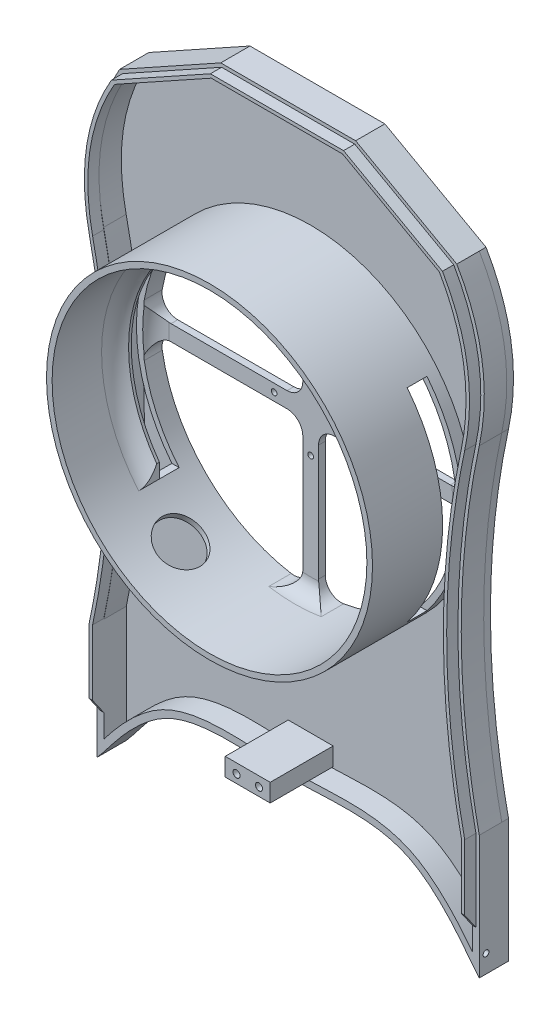
from build123d import *

# Parameters (mm, degrees)
ESQUISSE1_R                  = 70
ESQUISSE1_W                  = 20
ESQUISSE1_H                  = 39.999999999999986
BOSS_EXTRU_1_DEPTH           = 3
ESQUISSE2_W                  = 20
ESQUISSE2_H                  = 8.000000000000004
ESQUISSE2_H_2                = 8.000000000000014
BOSS_EXTRU_2_DEPTH           = 28
ESQUISSE3_R                  = 72.50000000000001
ESQUISSE3_R_2                = 70
BOSS_EXTRU_3_DEPTH           = 45
ESQUISSE4_W                  = 20
ESQUISSE4_H                  = 39.999999999999986
BOSS_EXTRU_4_DEPTH           = 3
BOSS_EXTRU_5_DEPTH           = 13
BOSS_EXTRU_6_DEPTH           = 5
BOSS_EXTRU_7_DEPTH           = 3
CONG_1_DEPTH                 = 10.0000001
CONG_1_2_DEPTH               = 3
ESQUISSE12_R                 = 9.999999999999998
ENL_V_MAT_EXTRU_2_DEPTH      = 14
ESQUISSE13_R                 = 1.2499999999999996
ESQUISSE13_R_2               = 1.2499999999999847
ESQUISSE13_R_3               = 1.2500000000000029
ESQUISSE13_R_4               = 1.2500000000000113
ENL_V_MAT_EXTRU_3_DEPTH      = 10
CHANFREIN2_SIZE              = 15
CHANFREIN2_SIZE_2            = 21.422220101
D_GAGEMENT_M2_52_D           = 3.1
D_GAGEMENT_M2_52_DEPTH       = 10
D_GAGEMENT_M2_52_CSINK_D     = 3.15
D_GAGEMENT_M2_52_CSINK_ANGLE = 90
D_GAGEMENT_M2_52_TIP         = 0.9313339594927185
ENL_V_START                  = 70
ESQUISSE21_W                 = 19.999999999999993
ESQUISSE21_H                 = 10
ENL_V_MAT_EXTRU_4_DEPTH      = 155
BOSS_EXTRU_11_START          = 8
BOSS_EXTRU_11_DEPTH          = 10
ENL_V_MAT_EXTRU_7_DEPTH      = 18.999999999999954
ENL_V_MAT_EXTRU_8_DEPTH      = 8.999999999999957
CONG_6_R                     = 10
CONG_7_R                     = 10


with BuildPart() as part:
    # Esquisse1 → Boss.-Extru.1 (new body)
    with BuildSketch(Plane.XY):
        with BuildLine():
            Line((30, 283.6148203161553), (-30, 283.6148203161553))
            Line((-30, 283.6148203161553), (-75.00000000000001, 258.61482031615526))
            add(Edge.make_bspline(
                [(-75.00000000000001, 258.61482031615526), (-92.42781352708205, 228.5081985162863), (-85.00000000000001, 193.61482031615523)],
                knots=[0, 0, 0, 1, 1, 1], degree=2))
            add(Edge.make_bspline(
                [(-85.00000000000001, 193.61482031615523), (-68.93018343768246, 118.7283020617592), (-85, 43.614820316155225)],
                knots=[0, 0, 0, 1, 1, 1], degree=2))
            Line((-85, 43.614820316155225), (-85, -11.385179683844726))
            add(Edge.make_bspline(
                [(-85, -11.385179683844726), (-81.96838515032597, -8.05743631287527), (-76.79687441104645, -0.5113567415685818), (-66.11439663784589, 10.772785983298427), (-45.473822970943495, 28.2980372880793), (-19.570110111013104, 23.61482031612098), (-7.95e-15, 23.61482031615525)],
                knots=[-0.06126852860693532, -0.06126852860693532, -0.06126852860693532, -0.06126852860693532, 0.0714545913021146, 0.09714605397303369, 0.19564609810225558, 0.4999999999989369, 0.4999999999989369, 0.4999999999989369, 0.4999999999989369], degree=3))
            add(Edge.make_bspline(
                [(85, -11.38517968384474), (81.96838515032597, -8.057436312875248), (76.79687441104643, -0.5113567415685939), (66.1143966378459, 10.772785983298425), (45.47382297094348, 28.298037288079275), (19.570110111013104, 23.61482031612098), (-7.95e-15, 23.61482031615525)],
                knots=[-0.0612685286069355, -0.0612685286069355, -0.0612685286069355, -0.0612685286069355, 0.07145459130211457, 0.09714605397303369, 0.19564609810225558, 0.4999999999989369, 0.4999999999989369, 0.4999999999989369, 0.4999999999989369], degree=3))
            Line((85, -11.38517968384474), (85, 43.614820316155196))
            add(Edge.make_bspline(
                [(85.00000000000001, 193.61482031615523), (68.93018343768246, 118.7283020617592), (85, 43.614820316155196)],
                knots=[0, 0, 0, 1, 1, 1], degree=2))
            add(Edge.make_bspline(
                [(75.00000000000001, 258.61482031615526), (92.42781352708205, 228.50819851628628), (85.00000000000001, 193.61482031615523)],
                knots=[0, 0, 0, 1, 1, 1], degree=2))
            Line((75.00000000000001, 258.61482031615526), (30, 283.6148203161553))
        make_face()
        with Locations((-1.2e-16, 158.6148203161553)):
            Circle(ESQUISSE1_R, mode=Mode.SUBTRACT)
        Polygon((-82, 226.52145792770335), (-60.78679656440361, 205.30825449210684), (-11.28932188134522, 254.80572917516508), (-32.50252531694162, 276.01893261076157), align=None, mode=Mode.SUBTRACT)
        Polygon((60.78679656440361, 205.30825449210684), (11.28932188134522, 254.80572917516508), (32.50252531694162, 276.01893261076157), (82, 226.52145792770335), align=None, mode=Mode.SUBTRACT)
        with Locations((0, 55.4995854823676)):
            Rectangle(ESQUISSE1_W, ESQUISSE1_H, mode=Mode.SUBTRACT)
    extrude(amount=BOSS_EXTRU_1_DEPTH)

    # Esquisse2 → Boss.-Extru.2 (add)
    with BuildSketch(Plane.XY.offset(3)):
        with Locations((0, 31.499585482367607)):
            Rectangle(ESQUISSE2_W, ESQUISSE2_H)
        with Locations((0, 79.49958548236759)):
            Rectangle(ESQUISSE2_W, ESQUISSE2_H_2)
    extrude(amount=BOSS_EXTRU_2_DEPTH)

    # Esquisse3 → Boss.-Extru.3 (add)
    with BuildSketch(Plane.XY.offset(3)):
        with Locations(Location((-1.2e-16, 158.6148203161553, 0), (0, 0, 180))):
            Circle(ESQUISSE3_R)
        with Locations((-1.2e-16, 158.6148203161553)):
            Circle(ESQUISSE3_R_2, mode=Mode.SUBTRACT)
    extrude(amount=BOSS_EXTRU_3_DEPTH)

    # Esquisse4 → Boss.-Extru.4 (add)
    with BuildSketch(Plane(origin=(0, 0, 0), x_dir=(-1, 0, 0), z_dir=(0, 0, -1))):
        with Locations((0, 55.4995854823676)):
            Rectangle(ESQUISSE4_W, ESQUISSE4_H)
        Polygon((82, 226.52145792770335), (60.786796564403595, 205.30825449210684), (11.289321881345224, 254.80572917516508), (32.5025253169417, 276.0189326107615), align=None)
        Polygon((-82, 226.5214579277034), (-60.786796564403595, 205.30825449210684), (-11.289321881345224, 254.80572917516508), (-32.50252531694157, 276.01893261076157), align=None)
    extrude(amount=-BOSS_EXTRU_4_DEPTH)

    # Esquisse7 → Boss.-Extru.5 (add)
    with BuildSketch(Plane(origin=(0, 0, 0), x_dir=(-1, 0, 0), z_dir=(0, 0, -1))):
        with BuildLine():
            Line((-85.00000000300668, 43.61482030232988), (-85, -11.38517968384474))
            add(Edge.make_bspline(
                [(-85, -11.38517968384474), (-81.96838515032597, -8.057436312875248), (-76.79687441104643, -0.5113567415685939), (-66.1143966378459, 10.772785983298425), (-45.47382297094348, 28.298037288079275), (-19.570110111013104, 23.61482031612098), (7.95e-15, 23.61482031615525)],
                knots=[-0.0612685286069355, -0.0612685286069355, -0.0612685286069355, -0.0612685286069355, 0.07145459130211457, 0.09714605397303369, 0.19564609810225558, 0.4999999999989369, 0.4999999999989369, 0.4999999999989369, 0.4999999999989369], degree=3))
            add(Edge.make_bspline(
                [(7.95e-15, 23.61482031615525), (19.570110111013104, 23.61482031612098), (45.473822970943495, 28.2980372880793), (66.11439663784589, 10.772785983298427), (76.79687441104645, -0.5113567415685818), (81.96838515032597, -8.05743631287527), (85, -11.385179683844726)],
                knots=[-0.06126852860693532, -0.06126852860693532, -0.06126852860693532, -0.06126852860693532, 0.243085373289746, 0.34158541741896786, 0.367276880089887, 0.49999999999893696, 0.49999999999893696, 0.49999999999893696, 0.49999999999893696], degree=3))
            Line((85, -11.385179683844726), (85, 43.614820316155225))
            add(Edge.make_bspline(
                [(85, 43.614820316155225), (68.93018343730546, 118.72830206346005), (85.00000000069963, 193.61482031954668)],
                knots=[0, 0, 0, 1, 1, 1], degree=2))
            add(Edge.make_bspline(
                [(85.00000000069963, 193.61482031954668), (92.42781354091423, 228.50819858694288), (74.99999993081197, 258.61482043555964)],
                knots=[0, 0, 0, 1, 1, 1], degree=2))
            Line((74.99999993081197, 258.61482043555964), (30, 283.6148203161553))
            Line((30, 283.6148203161553), (-30, 283.6148203161553))
            Line((-30, 283.6148203161553), (-75.00000000000001, 258.6148203161552))
            add(Edge.make_bspline(
                [(-75.00000000000001, 258.6148203161552), (-92.42781352749573, 228.50819851560686), (-84.9999999997082, 193.61482031458087)],
                knots=[0, 0, 0, 1, 1, 1], degree=2))
            add(Edge.make_bspline(
                [(-84.9999999997082, 193.61482031458087), (-68.93018343641985, 118.72830205407783), (-85.00000000300668, 43.61482030232988)],
                knots=[0, 0, 0, 1, 1, 1], degree=2))
        make_face()
        with BuildLine():
            Line((-82.00000000298942, 43.29813740875661), (-82.00000000046484, -2.881948230767895))
            add(Edge.make_bspline(
                [(-82.00000000046484, -2.881948230767895), (-81.74758887919461, -2.5573191906772004), (-81.24788778698097, -1.915721981313908), (-80.19889714359618, -0.5779500442992964), (-78.82838055937837, 1.14413615694196), (-77.08231001751294, 3.26858048079266), (-74.62250331713605, 6.135499344934203), (-71.32221905349847, 9.663339212050094), (-67.04373462711776, 13.74902636799347), (-62.413654050339375, 17.54430692205476), (-57.434160972674555, 20.84954650545775), (-52.122819508505174, 23.410210157956122), (-44.81993316469171, 25.812608107223937), (-35.34088519646024, 27.266380874308805), (-23.65508269305504, 27.43800281826682), (-13.784180628681382, 26.993416448234804), (-5.884198417396422, 26.686995172186517), (-1.9641351402751233, 26.61482031615181), (-5.25366e-12, 26.61482031615525)],
                knots=[0.00387879301185991, 0.00387879301185991, 0.00387879301185991, 0.00387879301185991, 0.01163068687103298, 0.01938258073020606, 0.03488636844855222, 0.05039015616689838, 0.06589394388524453, 0.09690151932193684, 0.12790909475862916, 0.15891667019532146, 0.1899242456320138, 0.22093182106870612, 0.2519393965053984, 0.31395454737878303, 0.37596969825216764, 0.43798484912555224, 0.46899242456224455, 0.4999999999989369, 0.4999999999989369, 0.4999999999989369, 0.4999999999989369], degree=3))
            add(Edge.make_bspline(
                [(-5.25366e-12, 26.61482031615525), (1.9641351402848126, 26.61482031615181), (5.884198417425449, 26.686995172187217), (13.784180628749516, 26.993416448237916), (23.655082693171423, 27.43800281827109), (35.34088519663145, 27.266380874299582), (44.819933164904015, 25.812608107179003), (52.122819508744634, 23.410210157862313), (57.434160972930165, 20.849546505312016), (62.413654050599526, 17.54430692186186), (67.04373462738207, 13.749026367758288), (71.3222190537612, 9.66333921178537), (74.62250331739908, 6.1354993446411425), (77.08231001776934, 3.268580480486858), (78.82838055962917, 1.1441361566313242), (80.19889714384104, -0.577950044609259), (81.24788778722042, -1.9157219816205033), (81.74758887943085, -2.5573191909806505), (82.00000000069966, -2.881948231069862)],
                knots=[-0.06126852860693532, -0.06126852860693532, -0.06126852860693532, -0.06126852860693532, -0.03026095317009034, 0.00074662226675465, 0.06276177314044462, 0.1247769240141346, 0.18679207488782457, 0.21779965032466955, 0.24880722576151454, 0.27981480119835955, 0.3108223766352045, 0.34182995207204947, 0.3728375275088945, 0.38834131522731696, 0.4038451029457395, 0.419348890664162, 0.4271007845233732, 0.43485267838258446, 0.43485267838258446, 0.43485267838258446, 0.43485267838258446], degree=3))
            Line((82.00000000069966, -2.881948231069862), (82.00000000067097, 43.29813741899179))
            add(Edge.make_bspline(
                [(82.00000000067097, 43.29813741899179), (81.33102916154041, 46.43791363807862), (80.0708459202374, 52.7462448934385), (77.89276900780747, 65.33171231348604), (75.79783241381435, 81.07201672041492), (74.29320015678675, 99.95165906042455), (73.79696955750731, 118.82683014148617), (74.30967373844007, 137.6950290696561), (75.8308271228173, 156.55386439120204), (77.9395452141792, 172.26499873918505), (80.12878829819708, 184.8206522136442), (81.39439988849415, 191.11083936856429), (82.0662536642805, 194.2418279441001)],
                knots=[0.4985417972747512, 0.4985417972747512, 0.4985417972747512, 0.4985417972747512, 0.4987185948050439, 0.49889539233533664, 0.49924898739592205, 0.4996025824565075, 0.499956177517093, 0.5003097725776784, 0.5006633676382639, 0.5010169626988493, 0.5011937602291421, 0.5013705577594347, 0.5013705577594347, 0.5013705577594347, 0.5013705577594347], degree=3))
            add(Edge.make_bspline(
                [(82.0662536642805, 194.2418279441001), (82.36083731312056, 195.625839445594), (82.89742485421858, 198.4235503613443), (83.714251033711, 203.91838292941813), (84.27758065412904, 210.70054894684807), (84.21838333393626, 218.67408101126492), (83.42843935890235, 226.4975170788434), (81.90762625843804, 234.17659603057092), (79.65542424064712, 241.7178864599615), (77.16315284471366, 247.8980603693058), (74.80418141442156, 252.7705468603318), (73.49135669425267, 255.2028339850259), (72.81286109097238, 256.39802085383036)],
                knots=[0.49861944776737316, 0.49861944776737316, 0.49861944776737316, 0.49861944776737316, 0.4987747460750024, 0.49893004438263155, 0.4992406409978899, 0.4995512376131483, 0.4998618342284067, 0.500172430843665, 0.5004830274589235, 0.5007936240741819, 0.5009489223818111, 0.5011042206894403, 0.5011042206894403, 0.5011042206894403, 0.5011042206894403], degree=3))
            Line((72.81286109097238, 256.39802085383036), (29.222621915407792, 280.6148203161553))
            Line((29.222621915407792, 280.6148203161553), (-29.222621915407792, 280.6148203161553))
            Line((-29.222621915407792, 280.6148203161553), (-72.81286115702135, 256.3980207374735))
            add(Edge.make_bspline(
                [(-72.81286115702135, 256.3980207374735), (-73.49135675770529, 255.20283386941583), (-74.80418147269755, 252.77054674641414), (-77.16315289318865, 247.89806025867443), (-79.655424277748, 241.71788635360764), (-81.90762628328918, 234.17659592945458), (-83.42843937301045, 226.49751698317462), (-84.218383338522, 218.67408092119987), (-84.27758065075236, 210.70054886257512), (-83.71425102470224, 203.91838285019602), (-82.89742484138752, 198.42355028626702), (-82.36083729863131, 195.62583937265438), (-82.06625364901512, 194.24182787224035)],
                knots=[0.4988957793155621, 0.4988957793155621, 0.4988957793155621, 0.4988957793155621, 0.49905107762304524, 0.4992063759305283, 0.49951697254549443, 0.4998275691604606, 0.5001381657754268, 0.500448762390393, 0.5007593590053592, 0.5010699556203253, 0.5012252539278084, 0.5013805522352915, 0.5013805522352915, 0.5013805522352915, 0.5013805522352915], degree=3))
            add(Edge.make_bspline(
                [(-82.06625364901512, 194.24182787224035), (-81.39439987413624, 191.11083929796692), (-80.12878828563427, 184.82065214561896), (-77.9395452048241, 172.26499867626123), (-75.8308271170397, 156.55386433468965), (-74.30967373607704, 137.6950290208267), (-73.79696955781702, 118.82683010037148), (-74.29320015883634, 99.95165902701439), (-75.79783241678282, 81.07201669472563), (-77.89276901092492, 65.33171229423937), (-80.0708459229719, 52.746244879335), (-81.33102916404124, 46.437913626564146), (-82.00000000298942, 43.29813740875661)],
                knots=[0.49862944224191336, 0.49862944224191336, 0.49862944224191336, 0.49862944224191336, 0.4988062397721338, 0.49898303730235416, 0.4993366323627949, 0.49969022742323566, 0.5000438224836764, 0.5003974175441172, 0.5007510126045579, 0.5011046076649986, 0.501281405195219, 0.5014582027254394, 0.5014582027254394, 0.5014582027254394, 0.5014582027254394], degree=3))
        make_face(mode=Mode.SUBTRACT)
    extrude(amount=-BOSS_EXTRU_5_DEPTH)

    # Esquisse8 → Boss.-Extru.6 (add)
    with BuildSketch(Plane.XY.offset(13)):
        with BuildLine():
            Line((-82, 43.61482031644215), (-82, -6.90551327659124))
            Line((-82, -6.90551327659124), (-83.5, -6.905513276591239))
            Line((-83.5, -6.905513276591239), (-83.5, 43.61482031644215))
            add(Edge.make_bspline(
                [(-83.50000000088828, 193.50011049071497), (-82.83344405827677, 190.3905239693707), (-81.577951458443, 184.14319243952028), (-79.40713568871776, 171.67423118622528), (-77.31788584062184, 156.0727347749064), (-75.81415885670212, 137.34702003639742), (-75.31278592210667, 118.61280327347806), (-75.8142080661502, 99.87179495409445), (-77.31795154616925, 81.12582175437683), (-79.40723217029269, 65.49591552787746), (-81.57794223962846, 52.99795873080648), (-82.83356483988493, 46.732925973545925), (-83.5, 43.61482031644215)],
                knots=[0.49862941941988015, 0.49862941941988015, 0.49862941941988015, 0.49862941941988015, 0.49880639973469565, 0.49898338004951115, 0.49933734067914215, 0.49969130130877315, 0.5000452619384042, 0.5003992225680352, 0.5007531831976662, 0.5011071438272972, 0.5012841241421127, 0.501461104456928, 0.501461104456928, 0.501461104456928, 0.501461104456928], degree=3))
            add(Edge.make_bspline(
                [(-73.62917849436529, 257.66044962225794), (-74.33950662751099, 256.4308483343103), (-75.71438979906296, 253.92813612044557), (-78.18863651518429, 248.90927399636368), (-80.80851156020276, 242.5359677522343), (-83.18480823294743, 234.74915438023984), (-84.79906960239148, 226.81401410649843), (-85.651061224971, 218.72767442266885), (-85.74123079952483, 210.4880543229445), (-85.1788699766159, 203.48412934015803), (-84.34883783972245, 197.81307592405906), (-83.80121010695215, 194.9277431075947), (-83.50000000088828, 193.50011049071497)],
                knots=[0.4988802353750164, 0.4988802353750164, 0.4988802353750164, 0.4988802353750164, 0.4990368621426199, 0.4991934889102233, 0.49950674244543025, 0.49981999598063714, 0.500133249515844, 0.500446503051051, 0.5007597565862578, 0.5010730101214648, 0.5012296368890683, 0.5013862636566717, 0.5013862636566717, 0.5013862636566717, 0.5013862636566717], degree=3))
            Line((-73.62917849436529, 257.66044962225794), (-29.611310959906433, 282.1148203162139))
            Line((-29.611310959906433, 282.1148203162139), (29.611310957703903, 282.1148203162139))
            Line((29.611310957703903, 282.1148203162139), (73.62917863107192, 257.6604493865649))
            add(Edge.make_bspline(
                [(83.50000001638345, 193.50011056565933), (83.80018036642666, 194.92712101119932), (84.34580384133966, 197.81105328880346), (85.17244375764085, 203.47991068237147), (85.7315332573726, 210.48166152022984), (85.6390316265877, 218.71976454355476), (84.78627187254959, 226.80562419848658), (83.17280201123295, 234.74131846526842), (80.79885021333278, 242.52970014832113), (78.18224028064766, 248.90513582189507), (75.71137383547376, 253.92620783941894), (74.33847963034299, 256.4301607850666), (73.62917863107192, 257.6604493865649)],
                knots=[0.4986194030973504, 0.4986194030973504, 0.4986194030973504, 0.4986194030973504, 0.49877567569220316, 0.49893194828705584, 0.49924449347676125, 0.4995570386664667, 0.49986958385617214, 0.5001821290458776, 0.500494674235583, 0.5008072194252884, 0.5009634920201411, 0.5011197646149939, 0.5011197646149939, 0.5011197646149939, 0.5011197646149939], degree=3))
            add(Edge.make_bspline(
                [(83.50000000132022, 43.61482031606817), (82.83475870600542, 46.73318650533274), (81.58139596009276, 52.998660630681975), (79.41458270266664, 65.49742601085869), (77.32905594770482, 81.12809202298533), (75.8280126146142, 99.87461280876356), (75.32749017494459, 118.61579812422342), (75.82796082624287, 137.34982431293489), (77.328986799922, 156.07499026255138), (79.4144811529493, 171.6757088896715), (81.5814056785719, 184.14390965505615), (82.83463157126009, 190.39072438520805), (83.50000001638345, 193.50011056565933)],
                knots=[0.49853889554254727, 0.49853889554254727, 0.49853889554254727, 0.49853889554254727, 0.4987155589278016, 0.498892222313056, 0.4992455490835648, 0.4995988758540735, 0.49995220262458223, 0.500305529395091, 0.5006588561655997, 0.5010121829361085, 0.5011888463213628, 0.5013655097066172, 0.5013655097066172, 0.5013655097066172, 0.5013655097066172], degree=3))
            Line((83.50000000132022, 43.61482031606817), (83.50000000132023, -6.905513276047638))
            Line((83.50000000132023, -6.905513276047638), (82.0000000013202, -6.905513276047638))
            Line((82.0000000013202, -6.905513276047638), (82.00000000132022, 43.614820316320746))
            add(Edge.make_bspline(
                [(82.00000000132022, 43.614820316320746), (81.33723947816034, 46.7304185758104), (80.08860483794061, 52.99004603333315), (77.92973886842202, 65.47834652832897), (75.85170867994044, 81.09689814642189), (74.3559276694107, 99.83021966050596), (73.85712408007983, 118.55881129989208), (74.35582532571837, 137.28020283223125), (75.85155860923669, 155.9920443312817), (77.92956295961693, 171.58046382349616), (80.08857296474383, 184.03800183806794), (81.33709595783976, 190.2788434913582), (82.00000001600993, 193.38540073711252)],
                knots=[0.4985417972742992, 0.4985417972742992, 0.4985417972742992, 0.4985417972742992, 0.4987179628294005, 0.49889412838450187, 0.4992464594947046, 0.4995987906049073, 0.49995112171511, 0.5003034528253127, 0.5006557839355155, 0.5010081150457182, 0.5011842806008195, 0.5013604461559208, 0.5013604461559208, 0.5013604461559208, 0.5013604461559208], degree=3))
            add(Edge.make_bspline(
                [(82.00000001600993, 193.38540073711252), (82.29346048041762, 194.7978226687351), (82.82663064355893, 197.652671948952), (83.63212881646899, 203.25855197382828), (84.1728138230599, 210.1755768728673), (84.07294491481852, 218.3040814933408), (83.22884367918861, 226.27594557999853), (81.64035681701036, 234.097019158183), (79.3069218593897, 241.7739961532146), (76.7354887728885, 248.06216221105439), (74.30643259045006, 253.01783735470096), (72.95598863558249, 255.49098090717476), (72.25835726199485, 256.70607845699425)],
                knots=[0.4986194477654942, 0.4986194477654942, 0.4986194477654942, 0.4986194477654942, 0.49877474607292827, 0.49893004438036226, 0.49924064099523024, 0.49955123761009823, 0.4998618342249662, 0.5001724308398343, 0.5004830274547023, 0.5007936240695703, 0.5009489223770043, 0.5011042206844383, 0.5011042206844383, 0.5011042206844383, 0.5011042206844383], degree=3))
            Line((72.25835726199485, 256.70607845699425), (29.22262191540775, 280.61482031620943))
            Line((29.22262191540775, 280.61482031620943), (-29.22262191981294, 280.61482031620943))
            Line((-29.22262191981294, 280.61482031620943), (-72.25835712695147, 256.70607868945))
            add(Edge.make_bspline(
                [(-72.25835712695147, 256.70607868945), (-72.95802915898925, 255.49237495479287), (-74.3124255714403, 253.0217514261781), (-76.74818614881062, 248.07058644741224), (-79.32608618630489, 241.78680651383777), (-81.66416789336581, 234.1131182441957), (-83.2542409587311, 226.29326705332315), (-84.09685129946305, 218.32048126899335), (-84.19212482292441, 210.18887550068112), (-83.64494985678338, 203.26734405789813), (-82.83269364294611, 197.65689006930367), (-82.29551867414538, 194.7991227406761), (-82.00000000088761, 193.38540066107288)],
                knots=[0.49889577930555873, 0.49889577930555873, 0.49889577930555873, 0.49889577930555873, 0.4990517932109185, 0.49920780711627827, 0.4995198349269978, 0.49983186273771735, 0.5001438905484369, 0.5004559183591564, 0.500767946169876, 0.5010799739805956, 0.5012359878859554, 0.501392001791315, 0.501392001791315, 0.501392001791315, 0.501392001791315], degree=3))
            add(Edge.make_bspline(
                [(-82.00000000088761, 193.38540066107288), (-81.3347314968121, 190.278453621151), (-80.08169577162528, 184.03660279876092), (-77.91493577123617, 171.57757879671476), (-75.82944919031709, 155.9876334862995), (-74.32833162609424, 137.2747071267769), (-73.8278296440052, 118.55292913279284), (-74.32842400540483, 99.82467258306185), (-75.82958464198126, 81.09241870233988), (-77.91509451247629, 65.47536081133588), (-80.0817245429236, 52.98865662559274), (-81.33486099358275, 46.72990274865894), (-82, 43.61482031644215)],
                knots=[0.4986294422430372, 0.4986294422430372, 0.4986294422430372, 0.4986294422430372, 0.49880623977317085, 0.4989830373033045, 0.4993366323635719, 0.4996902274238393, 0.5000438224841066, 0.500397417544374, 0.5007510126046413, 0.5011046076649086, 0.5012814051950423, 0.501458202725176, 0.501458202725176, 0.501458202725176, 0.501458202725176], degree=3))
        make_face()
    extrude(amount=BOSS_EXTRU_6_DEPTH)

    # Esquisse9 → Boss.-Extru.7 (add)
    with BuildSketch(Plane(origin=(0, 0, 0), x_dir=(-1, 0, 0), z_dir=(0, 0, -1))):
        Polygon((-3.5, 228.6148203161553), (-3.5000000000000013, 162.1148203161553), (-70, 162.1148203161553), (-70, 155.1148203161553), (-3.5000000000000013, 155.1148203161553), (-3.5, 88.61482031615527), (3.5, 88.61482031615527), (3.500000000000002, 155.1148203161553), (70, 155.1148203161553), (70, 162.1148203161553), (3.5000000000000013, 162.1148203161553), (3.5, 228.6148203161553), align=None)
    extrude(amount=-BOSS_EXTRU_7_DEPTH)

    # Congé1: read off the stored shape, not the designer's step
    # Congé1 outline → Congé1 (add)
    with BuildSketch(Plane.XY):
        with BuildLine():
            ThreePointArc((-11.666666667, 89.593889513), (0, 88.614820316), (11.666666667, 89.593889513))
            ThreePointArc((11.666666667, 89.593889513), (5.981519429, 91.149644283), (3.5, 96.495982594))
            Line((3.5, 96.495982594), (3.5, 155.114820316))
            Line((3.5, 155.114820316), (62.118837723, 155.114820316))
            ThreePointArc((62.118837723, 155.114820316), (67.465176034, 152.633300886), (69.020930803, 146.948153649))
            ThreePointArc((69.020930803, 146.948153649), (70, 158.614820316), (69.020930803, 170.281486983))
            ThreePointArc((69.020930803, 170.281486983), (67.465176033, 164.596339746), (62.118837723, 162.114820316))
            Line((62.118837723, 162.114820316), (3.5, 162.114820316))
            Line((3.5, 162.114820316), (3.5, 220.733658039))
            ThreePointArc((3.5, 220.733658039), (5.98151943, 226.07999635), (11.666666667, 227.635751119))
            ThreePointArc((11.666666667, 227.635751119), (0, 228.614820316), (-11.666666667, 227.635751119))
            ThreePointArc((-11.666666667, 227.635751119), (-5.98151943, 226.07999635), (-3.5, 220.733658039))
            Line((-3.5, 220.733658039), (-3.5, 162.114820316))
            Line((-3.5, 162.114820316), (-62.118837723, 162.114820316))
            ThreePointArc((-62.118837723, 162.114820316), (-67.465176033, 164.596339746), (-69.020930803, 170.281486983))
            ThreePointArc((-69.020930803, 170.281486983), (-70, 158.614820316), (-69.020930803, 146.948153649))
            ThreePointArc((-69.020930803, 146.948153649), (-67.465176034, 152.633300886), (-62.118837723, 155.114820316))
            Line((-62.118837723, 155.114820316), (-3.5, 155.114820316))
            Line((-3.5, 155.114820316), (-3.5, 96.495982594))
            ThreePointArc((-3.5, 96.495982594), (-5.981519429, 91.149644283), (-11.666666667, 89.593889513))
        make_face()
    extrude(amount=CONG_1_DEPTH)

    # Cong_1 2 outline → Cong_1 2 (add)
    with BuildSketch(Plane.XY):
        with BuildLine():
            ThreePointArc((-10.5, 155.114820316), (-5.550252532, 153.064567784), (-3.5, 148.114820316))
            Line((-3.5, 148.114820316), (-3.5, 155.114820316))
            Line((-3.5, 155.114820316), (-10.5, 155.114820316))
        make_face()
        with BuildLine():
            Line((3.5, 155.114820316), (3.5, 148.114820316))
            ThreePointArc((3.5, 148.114820316), (5.550252532, 153.064567784), (10.5, 155.114820316))
            Line((10.5, 155.114820316), (3.5, 155.114820316))
        make_face()
        with BuildLine():
            ThreePointArc((-3.5, 169.114820316), (-5.550252532, 164.165072848), (-10.5, 162.114820316))
            Line((-10.5, 162.114820316), (-3.5, 162.114820316))
            Line((-3.5, 162.114820316), (-3.5, 169.114820316))
        make_face()
        with BuildLine():
            Line((3.5, 162.114820316), (10.5, 162.114820316))
            ThreePointArc((10.5, 162.114820316), (5.550252532, 164.165072848), (3.5, 169.114820316))
            Line((3.5, 169.114820316), (3.5, 162.114820316))
        make_face()
    extrude(amount=CONG_1_2_DEPTH)

    # Cong_1 3 outline → Cong_1 3 (revolve, cut)
    with BuildSketch(Plane.XZ.offset(-158.614820316)):
        with BuildLine():
            Line((0, 10.0000001), (0, 3))
            Line((0, 3), (63, 3))
            ThreePointArc((63, 3), (67.949747468, 5.050252532), (70, 10))
            Line((70, 10), (0, 10.0000001))
        make_face()
    revolve(axis=Axis((0, 158.614820316, 0), (0, 0, 1)), mode=Mode.SUBTRACT)

    # Esquisse12 → Enlèv. mat.-Extru.2 (cut)
    with BuildSketch(Plane(origin=(32.43223190524735, 56.17427346274418, 0), x_dir=(0, 0, -1), z_dir=(-0.5000000000000041, -0.8660254037844364, 0))):
        with Locations(Location((-23, -82.83270794216602, 0), (0, 0, 90))):
            Circle(ESQUISSE12_R)
    extrude(amount=-ENL_V_MAT_EXTRU_2_DEPTH, mode=Mode.SUBTRACT)

    # Esquisse13 → Enlèv. mat.-Extru.3 (cut)
    with BuildSketch(Plane.XY.offset(3)):
        with Locations((-16.25, 158.6148203161553)):
            Circle(ESQUISSE13_R)
        with Locations((-1.6653e-13, 174.86482031615546)):
            Circle(ESQUISSE13_R_2)
        with Locations((16.249999999999936, 158.61482031615557)):
            Circle(ESQUISSE13_R_3)
        with Locations((0, 142.36482031615546)):
            Circle(ESQUISSE13_R_4)
    extrude(amount=-ENL_V_MAT_EXTRU_3_DEPTH, mode=Mode.SUBTRACT)

    # Chanfrein2
    # the kernel refuses this chamfer: 21.422220101, 15 mm, written as the material it takes off along each edge
    with BuildSketch(Plane(origin=(138.82400230113143, -6.905513276047638, 18), x_dir=(0, 0, -1), z_dir=(-1, 0, 0))) as chanfrein2_piece_1_section:
        Polygon((CHANFREIN2_SIZE, 0), (0, -CHANFREIN2_SIZE_2), (0, 0), align=None)
    chanfrein2_piece_1 = extrude(amount=112.14800459962244, mode=Mode.PRIVATE)
    chanfrein2_piece_1 = split(chanfrein2_piece_1, bisect_by=Plane(origin=(138.82400230113143, -6.905513276047638, 13), z_dir=(0, 0, 1)), keep=Keep.TOP, mode=Mode.PRIVATE)
    add(chanfrein2_piece_1, mode=Mode.SUBTRACT)
    with BuildSketch(Plane(origin=(-26.675997700188844, -6.905513276591273, 18), x_dir=(0, 0, -1), z_dir=(-1, 5.9e-16, 0))) as chanfrein2_piece_2_section:
        Polygon((CHANFREIN2_SIZE, 0), (0, -CHANFREIN2_SIZE_2), (0, 0), align=None)
    chanfrein2_piece_2 = extrude(amount=112.14800459962231, mode=Mode.PRIVATE)
    chanfrein2_piece_2 = split(chanfrein2_piece_2, bisect_by=Plane(origin=(-26.675997700188844, -6.905513276591273, 13), z_dir=(0, 0, 1)), keep=Keep.TOP, mode=Mode.PRIVATE)
    add(chanfrein2_piece_2, mode=Mode.SUBTRACT)

    # Dégagement M2.52
    with Locations(Plane.XY.offset(31)):
        with Locations((-5, 79.249585482), (5, 79.249585482), (-5, 31.249585482), (5, 31.249585482)):
            CounterSinkHole(D_GAGEMENT_M2_52_D / 2, D_GAGEMENT_M2_52_CSINK_D / 2, depth=D_GAGEMENT_M2_52_DEPTH, counter_sink_angle=D_GAGEMENT_M2_52_CSINK_ANGLE)
            with Locations((0, 0, -(D_GAGEMENT_M2_52_DEPTH + D_GAGEMENT_M2_52_TIP / 2))):  # 118° drill point
                Cone(0, D_GAGEMENT_M2_52_D / 2, D_GAGEMENT_M2_52_TIP, mode=Mode.SUBTRACT)

    # Esquisse20 → Dégagement M21 (revolve, cut)
    with BuildSketch(Plane(origin=(-85, -3.385179683844726, 10), x_dir=(0, 0, 1), z_dir=(0, 1, 0))):
        Polygon((0, 0), (-1.17e-15, 4.781118804735829), (1.2999999999999992, 4), (1.2999999999999905, 0.02500000000001112), (1.3249999999999997, -1.73e-15), align=None)
    d_gagement_m21 = revolve(axis=Axis((-91.35, -3.385179683844726, 10), (1, 0, 0)), mode=Mode.SUBTRACT)

    # Symétrie1: Dégagement M21 across plane
    add(d_gagement_m21.mirror(Plane(origin=(0, 0, 0), x_dir=(0, 0, 1), z_dir=(1, 0, 0))), mode=Mode.SUBTRACT)

    # Esquisse21 → Enlèv. mat.-Extru.4 (cut)
    with BuildSketch(Plane(origin=(0, 0, 0), x_dir=(1, 0, 0), z_dir=(0, 1, 0)).offset(ENL_V_START)):
        with Locations((-63.5, -13.000000000000004)):
            Rectangle(ESQUISSE21_W, ESQUISSE21_H)
    extrude(amount=ENL_V_MAT_EXTRU_4_DEPTH, mode=Mode.SUBTRACT)

    # Boss.-Extru.11: read off the stored shape, not the designer's step
    # Boss.-Extru.11 outline → Boss.-Extru.11 (add)
    with BuildSketch(Plane.XY.offset(BOSS_EXTRU_11_START)):
        with BuildLine():
            Line((-53.5, 109.686301025), (-53.5, 207.543339607))
            ThreePointArc((-53.5, 207.543339607), (-72.5, 158.614820316), (-53.5, 109.686301025))
        make_face()
    boss_extru_11 = extrude(amount=BOSS_EXTRU_11_DEPTH)

    # Esquisse23 → Enlèv. mat.-Extru.7 (cut)
    with BuildSketch(Plane(origin=(-53.5, 0, 0), x_dir=(0, 0, -1), z_dir=(1, 0, 0))):
        Polygon((-16.8, 203.75626468826198), (-16.799999999999994, 113.47337594404861), (-8.000000000000004, 113.47337594404861), (-8.000000000000004, 203.75626468826198), align=None)
    enl_v_mat_extru_7 = extrude(amount=-ENL_V_MAT_EXTRU_7_DEPTH, mode=Mode.SUBTRACT)

    # Esquisse24 → Enlèv. mat.-Extru.8 (cut)
    with BuildSketch(Plane.XY.offset(18.000000000000004)):
        with BuildLine():
            Line((-53.5, 119.96575823180447), (-53.5, 197.2638824005062))
            ThreePointArc((-53.500000000000014, 197.2638824005062), (-66.00000000000006, 158.61482031615535), (-53.50000000000001, 119.96575823180447))
        make_face()
    enl_v_mat_extru_8 = extrude(amount=-ENL_V_MAT_EXTRU_8_DEPTH, mode=Mode.SUBTRACT)

    # Congé6
    # the kernel refuses this fillet: 10 mm, written as the material it adds along each edge
    with BuildSketch(Plane(origin=(-1.2e-16, 158.6148203161553, 18.000000000000004), x_dir=(-0.5514715879866191, -0.8341936751399621, 0), z_dir=(0.8341936751399621, -0.5514715879866191, 0))) as cong_6_piece_1_section:
        with BuildLine():
            CenterArc((60, -7.999999999999968), CONG_6_R, 0, 53.130102354155675)
            Line((66.00000000000004, 0), (66.12000000000005, 0.16000000000000014))
            ThreePointArc((66.12000000000005, 0.16000000000000014), (68.00000000000003, 0.20000000000000284), (70.00000000000001, 0.1999999999999993))
            Line((70.00000000000001, 0.1999999999999993), (70.20000000000002, 0))
            Line((70.20000000000002, 0), (70.20000000000002, -7.999999999999968))
            Line((70.20000000000002, -7.999999999999968), (70.00000000000001, -7.999999999999968))
        make_face()
    cong_6_piece_1 = revolve(axis=Axis((-1.2e-16, 158.6148203161553, 18.000000000000004), (0, 0, -1)), revolution_arc=113.0639425204784, mode=Mode.PRIVATE)
    cong_6_piece_1 = split(cong_6_piece_1, bisect_by=Plane(origin=(-53.5, 158.6148203161553, 18.000000000000004), z_dir=(-1, 0, 0)), keep=Keep.TOP, mode=Mode.PRIVATE)
    add(cong_6_piece_1)

    # Symétrie3: Boss.-Extru.11, Enlèv. mat.-Extru.7, Enlèv. mat.-Extru.8 across plane
    add(boss_extru_11.mirror(Plane(origin=(0, 0, 0), x_dir=(0, 0, 1), z_dir=(1, 0, 0))))
    add(enl_v_mat_extru_7.mirror(Plane(origin=(0, 0, 0), x_dir=(0, 0, 1), z_dir=(1, 0, 0))), mode=Mode.SUBTRACT)
    add(enl_v_mat_extru_8.mirror(Plane(origin=(0, 0, 0), x_dir=(0, 0, 1), z_dir=(1, 0, 0))), mode=Mode.SUBTRACT)

    # Congé7
    # the kernel refuses this fillet: 10 mm, written as the material it adds along each edge
    with BuildSketch(Plane(origin=(-1.2e-16, 158.6148203161553, 18), x_dir=(1, 0, 0), z_dir=(0, 1, 0))) as cong_7_piece_1_section:
        with BuildLine():
            CenterArc((60, -7.999999999999986), CONG_7_R, 0, 53.130102354155774)
            Line((66.00000000000003, -7.11e-15), (66.12000000000003, 0.15999999999999304))
            ThreePointArc((66.12000000000003, 0.15999999999999304), (68.00000000000003, 0.1999999999999993), (70, 0.1999999999999993))
            Line((70, 0.1999999999999993), (70.19999999999999, 0))
            Line((70.19999999999999, 0), (70.2, -7.999999999999986))
            Line((70.2, -7.999999999999986), (70, -7.999999999999986))
        make_face()
    cong_7_piece_1 = revolve(axis=Axis((-1.2e-16, 158.6148203161553, 18), (0, 0, -1)), revolution_arc=56.52804379024537, mode=Mode.PRIVATE)
    cong_7_piece_1 = split(cong_7_piece_1, bisect_by=Plane(origin=(53.5, 158.6148203161553, 18), z_dir=(1, 0, 0)), keep=Keep.TOP, mode=Mode.PRIVATE)
    add(cong_7_piece_1)
    with BuildSketch(Plane(origin=(-1.2e-16, 158.6148203161553, 18), x_dir=(0.5515287684006154, 0.8341558713013415, 0), z_dir=(-0.8341558713013415, 0.5515287684006154, 0))) as cong_7_piece_2_section:
        with BuildLine():
            CenterArc((59.99999999999998, -7.9999999999999565), CONG_7_R, 0, 53.13010235415546)
            Line((66.00000000000006, -3.55e-15), (66.12000000000006, 0.15999999999999656))
            ThreePointArc((66.12000000000006, 0.15999999999999656), (68, 0.19999999999999926), (69.99999999999999, 0.19999999999999926))
            Line((69.99999999999999, 0.19999999999999926), (70.19999999999999, 0))
            Line((70.19999999999999, 0), (70.2, -7.9999999999999565))
            Line((70.2, -7.9999999999999565), (70.00000000000001, -7.9999999999999565))
        make_face()
    cong_7_piece_2 = revolve(axis=Axis((-1.2e-16, 158.6148203161553, 18), (0, 0, -1)), revolution_arc=56.528043790245256, mode=Mode.PRIVATE)
    cong_7_piece_2 = split(cong_7_piece_2, bisect_by=Plane(origin=(53.5, 158.6148203161553, 18), z_dir=(1, 0, 0)), keep=Keep.TOP, mode=Mode.PRIVATE)
    add(cong_7_piece_2)


solid = part.part
